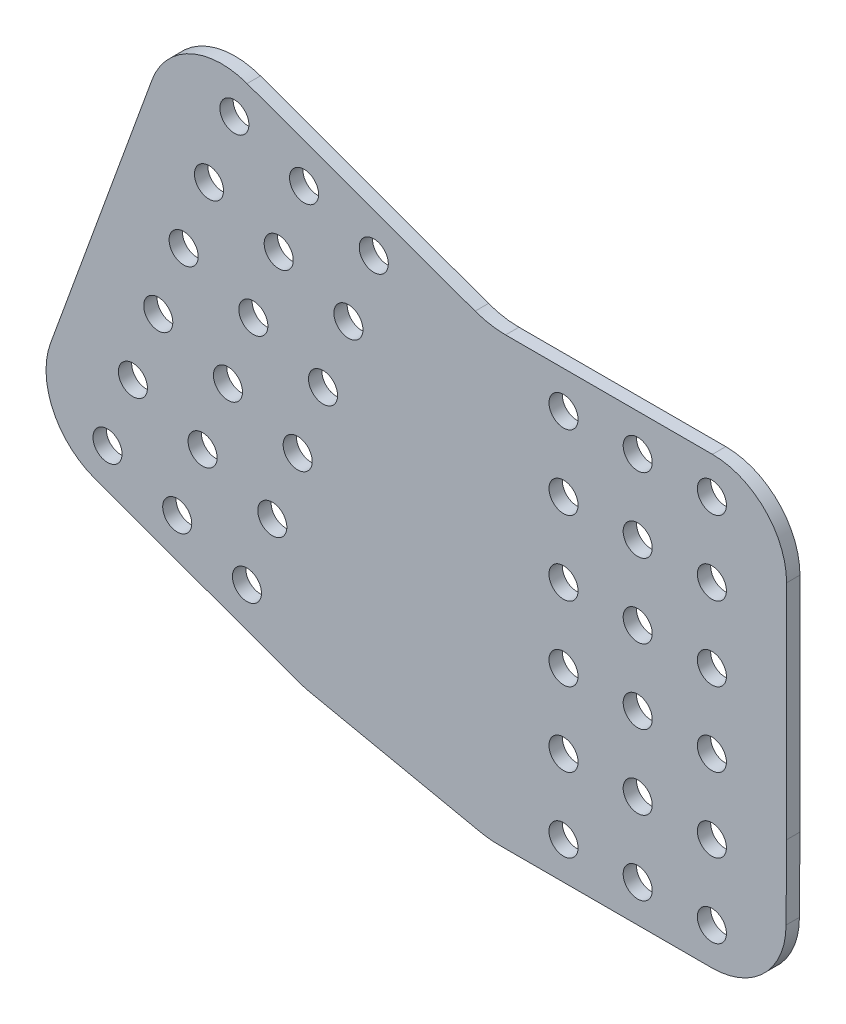
from build123d import *

# Parameters (mm, degrees)
SKETCH2_R           = 2.4892
SKETCH2_R_2         = 2.489199995
SKETCH2_R_3         = 2.489199998
BOSS_EXTRUDE1_DEPTH = 2.286
FILLET6_R           = 12.7
FILLET7_R           = 15.24


with BuildPart() as part:
    # Sketch2 → Boss-Extrude1 (new body)
    with BuildSketch(Plane.XY):
        Polygon((33.430156219, 560.153270419), (33.430156219, 610.953270419), (-17.369843781, 610.953270419), (-70.882869838, 630.430419049), (-92.601148921, 570.759937623), (-96.944804753, 558.825841343), (-49.208419617, 541.451218062), (-17.464279743, 534.753270419), (33.335720257, 534.753270419), (33.335720257, 547.453270419), align=None)
        with Locations((-4.764279743, 566.503270419)):
            Circle(SKETCH2_R, mode=Mode.SUBTRACT)
        with Locations((-4.764279743, 579.203270419)):
            Circle(SKETCH2_R, mode=Mode.SUBTRACT)
        with Locations((7.935720257, 566.503270419)):
            Circle(SKETCH2_R, mode=Mode.SUBTRACT)
        with Locations((20.635720257, 566.503270419)):
            Circle(SKETCH2_R, mode=Mode.SUBTRACT)
        with Locations((7.935720257, 579.203270419)):
            Circle(SKETCH2_R, mode=Mode.SUBTRACT)
        with Locations((20.635720257, 579.203270419)):
            Circle(SKETCH2_R, mode=Mode.SUBTRACT)
        with Locations((-4.764279743, 591.903270419)):
            Circle(SKETCH2_R, mode=Mode.SUBTRACT)
        with Locations((-4.764279743, 604.603270419)):
            Circle(SKETCH2_R, mode=Mode.SUBTRACT)
        with Locations((7.935720257, 591.903270419)):
            Circle(SKETCH2_R, mode=Mode.SUBTRACT)
        with Locations((20.635720257, 591.903270419)):
            Circle(SKETCH2_R, mode=Mode.SUBTRACT)
        with Locations((7.935720257, 604.603270419)):
            Circle(SKETCH2_R, mode=Mode.SUBTRACT)
        with Locations((20.635720257, 604.603270419)):
            Circle(SKETCH2_R, mode=Mode.SUBTRACT)
        with Locations((20.635720257, 553.803270419)):
            Circle(SKETCH2_R, mode=Mode.SUBTRACT)
        with Locations((-4.764279743, 553.803270419)):
            Circle(SKETCH2_R, mode=Mode.SUBTRACT)
        with Locations((7.935720257, 553.803270419)):
            Circle(SKETCH2_R, mode=Mode.SUBTRACT)
        with Locations((20.635720257, 541.103270419)):
            Circle(SKETCH2_R, mode=Mode.SUBTRACT)
        with Locations((7.935720257, 541.103270419)):
            Circle(SKETCH2_R, mode=Mode.SUBTRACT)
        with Locations((-4.764279743, 541.103270419)):
            Circle(SKETCH2_R, mode=Mode.SUBTRACT)
        with Locations((-37.25240889, 611.432403444)):
            Circle(SKETCH2_R, mode=Mode.SUBTRACT)
        with Locations((-50.283376351, 575.630114592)):
            Circle(SKETCH2_R, mode=Mode.SUBTRACT)
        with Locations((-62.217472635, 579.973770413)):
            Circle(SKETCH2_R, mode=Mode.SUBTRACT)
        with Locations((-74.151568919, 584.317426233)):
            Circle(SKETCH2_R, mode=Mode.SUBTRACT)
        with Locations((-69.80791745, 596.251510539)):
            Circle(SKETCH2_R_2, mode=Mode.SUBTRACT)
        with Locations((-45.93972488, 587.564198905)):
            Circle(SKETCH2_R_2, mode=Mode.SUBTRACT)
        with Locations((-57.873821165, 591.907854722)):
            Circle(SKETCH2_R_2, mode=Mode.SUBTRACT)
        with Locations((-53.530163169, 603.841956995)):
            Circle(SKETCH2_R_3, mode=Mode.SUBTRACT)
        with Locations((-41.596066884, 599.498301178)):
            Circle(SKETCH2_R_3, mode=Mode.SUBTRACT)
        with Locations((-65.464259454, 608.185612812)):
            Circle(SKETCH2_R_3, mode=Mode.SUBTRACT)
        with Locations((-61.120601458, 620.119715085)):
            Circle(SKETCH2_R, mode=Mode.SUBTRACT)
        with Locations((-49.186505174, 615.776059265)):
            Circle(SKETCH2_R, mode=Mode.SUBTRACT)
        with Locations((-78.495224739, 572.383329949)):
            Circle(SKETCH2_R, mode=Mode.SUBTRACT)
        with Locations((-54.627032171, 563.696018308)):
            Circle(SKETCH2_R, mode=Mode.SUBTRACT)
        with Locations((-66.561128455, 568.039674129)):
            Circle(SKETCH2_R, mode=Mode.SUBTRACT)
        with Locations((-58.970687991, 551.761922025)):
            Circle(SKETCH2_R, mode=Mode.SUBTRACT)
        with Locations((-82.838880559, 560.449233665)):
            Circle(SKETCH2_R, mode=Mode.SUBTRACT)
        with Locations((-70.904784275, 556.105577845)):
            Circle(SKETCH2_R, mode=Mode.SUBTRACT)
    extrude(amount=BOSS_EXTRUDE1_DEPTH)

    # Fillet6
    fillet6_edges = [part.edges().sort_by_distance(p)[0] for p in [
        (-70.882869838, 630.430419049, 1.143),
        (-96.944804753, 558.825841343, 1.143),
        (33.430156219, 610.953270419, 1.143),
        (33.335720257, 534.753270419, 1.143),
    ]]
    fillet(fillet6_edges, radius=FILLET6_R - 0.0001)  # a hair under: the kernel refuses the full size

    # Fillet7
    fillet7_edges = [part.edges().sort_by_distance(p)[0] for p in [
        (-17.464279743, 534.753270419, 1.143),
        (-49.208419617, 541.451218062, 1.143),
        (-17.369843781, 610.953270419, 1.143),
    ]]
    fillet(fillet7_edges, radius=FILLET7_R)


solid = part.part
